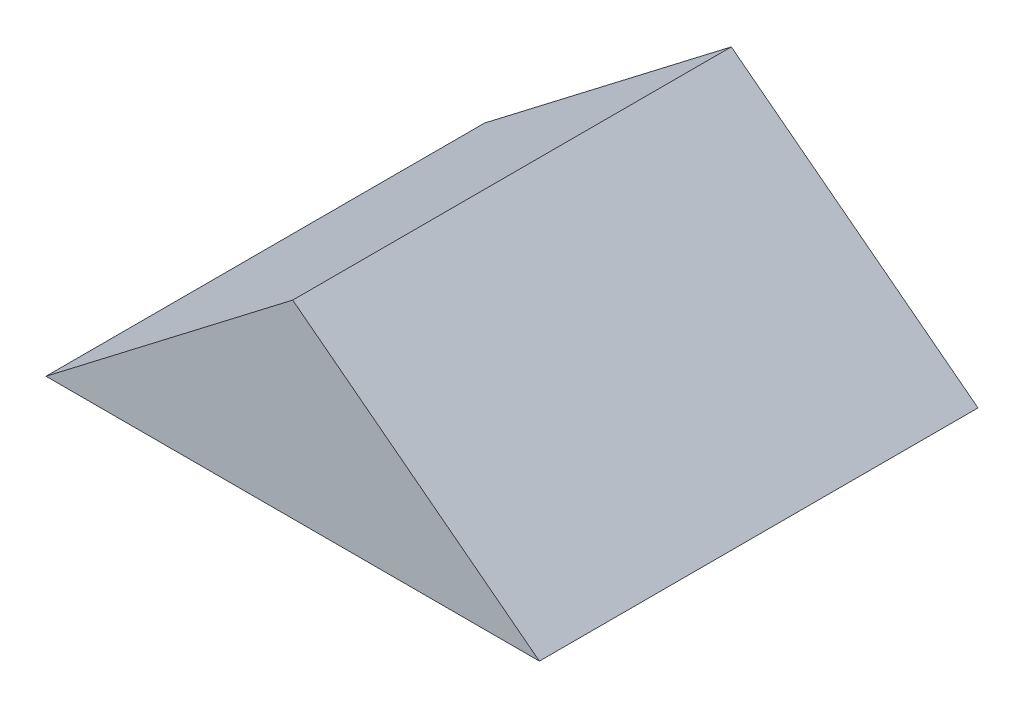
from build123d import *

# Parameters (mm, degrees)
BOSS_EXTRUDE1_DEPTH = 160
SKETCH2_W           = 160
SKETCH2_H           = 140
CUT_EXTRUDE1_DEPTH  = 5
SHELL1_START        = 7.5
SHELL1_DEPTH        = 145


# Read off the part's stored shape, not the designer's step: Shell1
with BuildPart() as part:
    # Sketch1 → Boss-Extrude1 (new body)
    with BuildSketch(Plane.XY):
        Polygon((0, 61.386159038), (-80, 0), (-90, -7.67326988), (90, -7.67326988), (80, 0), align=None)
    extrude(amount=BOSS_EXTRUDE1_DEPTH)

    # Sketch2 → Cut-Extrude1 (cut)
    with BuildSketch(Plane.XZ.offset(7.67326988)):
        with Locations((0, 80)):
            Rectangle(SKETCH2_W, SKETCH2_H)
    extrude(amount=-CUT_EXTRUDE1_DEPTH, mode=Mode.SUBTRACT)

    # Shell1 outline → Shell1 (cut)
    with BuildSketch(Plane.XY.offset(SHELL1_START)):
        Polygon((0, 51.932615933), (-71.163775898, -2.67326988), (71.163775898, -2.67326988), align=None)
    extrude(amount=SHELL1_DEPTH, mode=Mode.SUBTRACT)


solid = part.part
